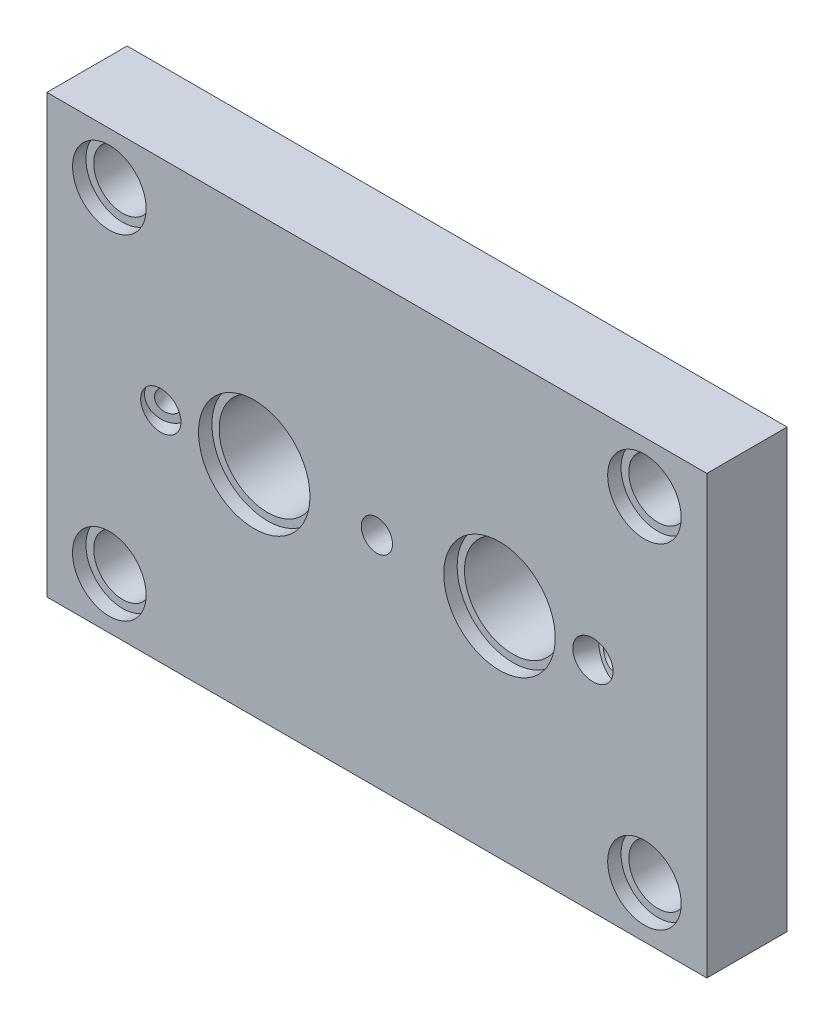
from build123d import *

# Parameters (mm, degrees)
SKETCH1_W      = 148
SKETCH1_H      = 196
SKETCH1_R      = 13
EXTRUDE1_DEPTH = 36
SKETCH2_R      = 21.720880237
EXTRUDE2_DEPTH = 182.118745579
SKETCH3_R      = 16.5
EXTRUDE3_DEPTH = 6
SKETCH5_R      = 25
EXTRUDE5_DEPTH = 6
SKETCH4_R      = 7
EXTRUDE4_DEPTH = 182.118745579


# Read off the part's stored shape, not the designer's step: Cavity1
with BuildPart() as part:
    # Sketch1 → Extrude1 (new body)
    with BuildSketch(Plane.XY):
        with Locations((-74, 0)):
            Rectangle(SKETCH1_W, SKETCH1_H)
        with Locations((-120, 75)):
            Circle(SKETCH1_R, mode=Mode.SUBTRACT)
        with Locations((-120, -75)):
            Circle(SKETCH1_R, mode=Mode.SUBTRACT)
    extrude(amount=EXTRUDE1_DEPTH)

    # Cavity1 outline → Cavity1 (revolve, cut)
    with BuildSketch(Plane(origin=(-55, 0, 0), x_dir=(1, 0, 0), z_dir=(0, -1, 0))):
        with BuildLine():
            Line((32.16, 1.5075), (21.720880237, 1.5075))
            ThreePointArc((21.720880237, 1.5075), (19.980169175, 1.111079032), (18.582768743, 0))
            Line((18.582768743, 0), (32.16, 0))
            Line((32.16, 0), (32.16, 1.5075))
        make_face()
    revolve(axis=Axis((-55, 0, 0), (0, 0, 1)), mode=Mode.SUBTRACT)

    # Sketch2 → Extrude2 (cut, through all)
    with BuildSketch(Plane.XY):
        with Locations((-55, 0)):
            Circle(SKETCH2_R)
    extrude(amount=EXTRUDE2_DEPTH, mode=Mode.SUBTRACT)

    # Sketch3 → Extrude3 (cut)
    with BuildSketch(Plane.XY.offset(36)):
        with Locations((-120, 75)):
            Circle(SKETCH3_R)
        with Locations((-120, -75)):
            Circle(SKETCH3_R)
    extrude(amount=-EXTRUDE3_DEPTH, mode=Mode.SUBTRACT)

    # Sketch5 → Extrude5 (cut)
    with BuildSketch(Plane.XY.offset(36)):
        with Locations((-55, 0)):
            Circle(SKETCH5_R)
    extrude(amount=-EXTRUDE5_DEPTH, mode=Mode.SUBTRACT)

    # Sketch7 → Cut-Revolve2 (revolve, cut)
    with BuildSketch(Plane(origin=(0, 0, 0), x_dir=(1, 0, 0), z_dir=(0, 1, 0))):
        Polygon((-116.584356678, 3.471349293), (-103.64765553, -32.071944992), (-106.936579703, -33.269015494), (-102.122979844, -46.494272413), (-94.135592567, -43.587101195), (-111.885893574, 5.18145001), align=None)
    revolve(axis=Axis((-116.086721699, 0, -16.723130427), (0.34202014332566283, 0, 0.9396926207859105)), mode=Mode.SUBTRACT)

    # Mirror1: part across plane


with BuildPart() as part_1:
    add(part.part)
    add(part.part.mirror(Plane(origin=(0, 0, 0), x_dir=(0, 0, 1), z_dir=(1, 0, 0))))

    # Sketch4 → Extrude4 (cut, through all)
    with BuildSketch(Plane.XY.offset(36)):
        Circle(SKETCH4_R)
    extrude(amount=-EXTRUDE4_DEPTH, mode=Mode.SUBTRACT)

    # Sketch6 → Cut-Revolve1 (revolve, cut)
    with BuildSketch(Plane(origin=(0, 0, 0), x_dir=(-1, 0, 0), z_dir=(0, 0, -1))):
        with BuildLine():
            Line((-17.34, 2.5), (17.34, 2.5))
            ThreePointArc((17.34, 2.5), (19.107766953, 1.767766953), (19.84, 0))
            Line((19.84, 0), (-19.84, 0))
            ThreePointArc((-19.84, 0), (-19.107766953, 1.767766953), (-17.34, 2.5))
        make_face()
    revolve(axis=Axis((55, 0, 0), (-1, 0, 0)), mode=Mode.SUBTRACT)


solid = part_1.part
